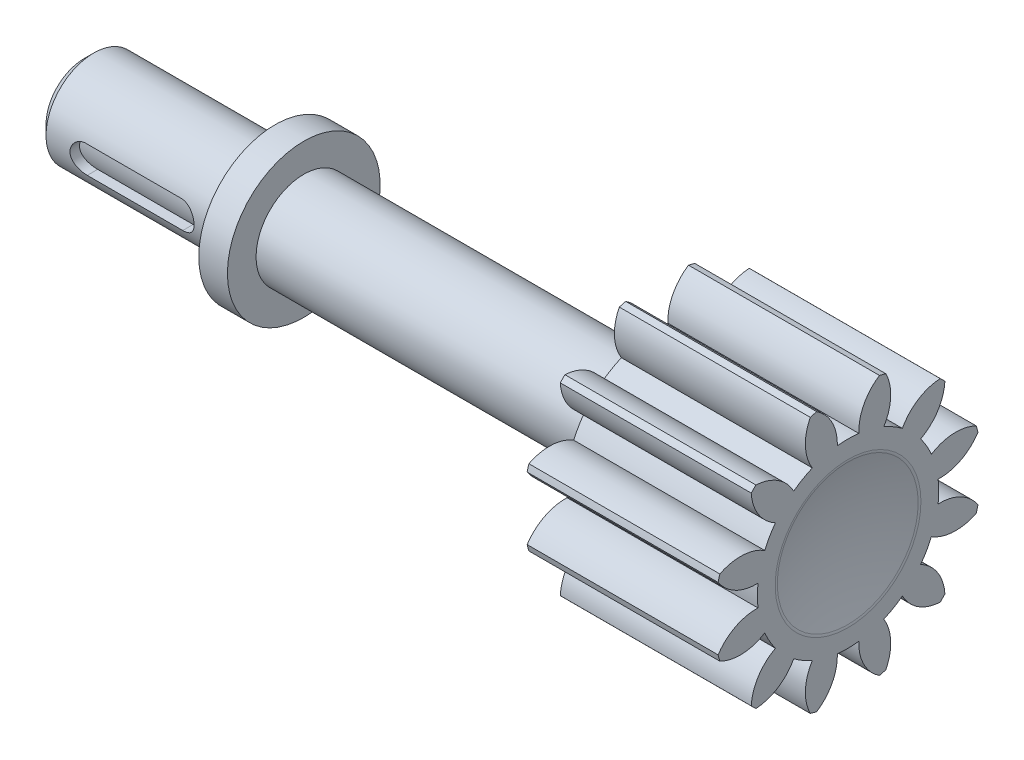
from build123d import *

# Parameters (mm, degrees)
SKETCH1_W                  = 10
SKETCH1_H                  = 7
CUT_EXTRUDE1_DEPTH         = 25.841675415
CUT_EXTRUDE2_DEPTH         = 25.841675415
CUT_EXTRUDE3_DEPTH         = 25.841675415
CUT_EXTRUDE4_DEPTH         = 25.841675415
CUT_EXTRUDE5_DEPTH         = 25.841675415
CUT_EXTRUDE6_DEPTH         = 25.841675415
CUT_EXTRUDE7_DEPTH         = 25.841675415
CUT_EXTRUDE8_DEPTH         = 25.841675415
CUT_EXTRUDE9_DEPTH         = 25.73038126
CUT_EXTRUDE10_DEPTH        = 25.73038126
CUT_EXTRUDE11_DEPTH        = 25.73038126
CUT_EXTRUDE12_DEPTH        = 25.590210189
SKETCH14_W                 = 30.0000508
SKETCH14_H                 = 2.5
F_0_8_0_8_DIAMETER_HOLE1_D = 0.8
BOSS_EXTRUDE1_START        = -40.0000508
SKETCH17_R                 = 0.4
BOSS_EXTRUDE1_DEPTH        = 40.0000508
SKETCH18_W                 = 1.5
SKETCH18_H                 = 1.5
CHAMFER1_SIZE              = 0.5
CUT_EXTRUDE13_REACH        = 34.638
CUT_EXTRUDE13_END_RADIUS   = 2
CUT_EXTRUDE13_START        = 5
FILLET1_R                  = 0.5


# Read off the part's stored shape, not the designer's step: Dome1
with BuildPart() as part:
    # Sketch1 → Revolve1 (revolve)
    with BuildSketch(Plane(origin=(0, 0, -7.196357143), x_dir=(-1, 0, 0), z_dir=(0, 0, -1)), mode=Mode.PRIVATE) as revolve1_sk:
        with Locations((-14.77870785, 14.264354232)):
            Rectangle(SKETCH1_W, SKETCH1_H)
    revolve(revolve1_sk.sketch.rotate(Axis((19.77870785, 10.764354232, -7.196357143), (-1, 0, 0)), 270), axis=Axis((19.77870785, 10.764354232, -7.196357143), (-1, 0, 0)))

    # Sketch2 → Cut-Extrude1 (cut, through all)
    with BuildSketch(Plane.ZY.offset(-9.77870785)):
        with BuildLine():
            ThreePointArc((-0.481894482, 12.743240579), (-1.134179317, 14.264354232), (-2.125359964, 15.589806295))
            ThreePointArc((-2.125359964, 15.589806295), (-2.500220073, 14.433413298), (-3.393627672, 13.609042188))
            ThreePointArc((-3.393627672, 13.609042188), (-3.083602501, 13.138854232), (-2.831420372, 12.635270579))
            ThreePointArc((-2.831420372, 12.635270579), (-1.670790249, 12.996798701), (-0.481894482, 12.743240579))
        make_face()
    extrude(amount=-CUT_EXTRUDE1_DEPTH, mode=Mode.SUBTRACT)

    # Sketch3 → Cut-Extrude2 (cut, through all)
    with BuildSketch(Plane.ZY.offset(-9.77870785)):
        with BuildLine():
            ThreePointArc((-0.392018732, 9.12088875), (-0.196357143, 10.764354232), (-0.392018732, 12.407819713))
            ThreePointArc((-0.392018732, 12.407819713), (-1.294853608, 11.593784056), (-2.480752839, 11.326561532))
            ThreePointArc((-2.480752839, 11.326561532), (-2.447357143, 10.764354232), (-2.480752839, 10.202146931))
            ThreePointArc((-2.480752839, 10.202146931), (-1.294853608, 9.934924408), (-0.392018732, 9.12088875))
        make_face()
    extrude(amount=-CUT_EXTRUDE2_DEPTH, mode=Mode.SUBTRACT)

    # Sketch4 → Cut-Extrude3 (cut, through all)
    with BuildSketch(Plane.ZY.offset(-9.77870785)):
        with BuildLine():
            ThreePointArc((-2.125359964, 5.938902169), (-1.134179317, 7.264354232), (-0.481894482, 8.785467884))
            ThreePointArc((-0.481894482, 8.785467884), (-1.670790249, 8.531909762), (-2.831420372, 8.893437884))
            ThreePointArc((-2.831420372, 8.893437884), (-3.083602501, 8.389854232), (-3.393627672, 7.919666275))
            ThreePointArc((-3.393627672, 7.919666275), (-2.500220073, 7.095295166), (-2.125359964, 5.938902169))
        make_face()
    extrude(amount=-CUT_EXTRUDE3_DEPTH, mode=Mode.SUBTRACT)

    # Sketch5 → Cut-Extrude4 (cut, through all)
    with BuildSketch(Plane.ZY.offset(-9.77870785)):
        with BuildLine():
            ThreePointArc((-5.217470795, 4.049891571), (-3.696357143, 4.702176405), (-2.37090508, 5.693357053))
            ThreePointArc((-2.37090508, 5.693357053), (-3.527298077, 6.068217161), (-4.351669187, 6.96162476))
            ThreePointArc((-4.351669187, 6.96162476), (-4.821857143, 6.651599589), (-5.325440796, 6.39941746))
            ThreePointArc((-5.325440796, 6.39941746), (-4.963912674, 5.238787337), (-5.217470795, 4.049891571))
        make_face()
    extrude(amount=-CUT_EXTRUDE4_DEPTH, mode=Mode.SUBTRACT)

    # Sketch6 → Cut-Extrude5 (cut, through all)
    with BuildSketch(Plane.ZY.offset(-9.77870785)):
        with BuildLine():
            ThreePointArc((-8.839822625, 3.960015821), (-7.196357143, 3.764354232), (-5.552891661, 3.960015821))
            ThreePointArc((-5.552891661, 3.960015821), (-6.366927319, 4.862850696), (-6.634149843, 6.048749928))
            ThreePointArc((-6.634149843, 6.048749928), (-7.196357143, 6.015354232), (-7.758564444, 6.048749928))
            ThreePointArc((-7.758564444, 6.048749928), (-8.025786967, 4.862850696), (-8.839822625, 3.960015821))
        make_face()
    extrude(amount=-CUT_EXTRUDE5_DEPTH, mode=Mode.SUBTRACT)

    # Sketch7 → Cut-Extrude6 (cut, through all)
    with BuildSketch(Plane.ZY.offset(-9.77870785)):
        with BuildLine():
            ThreePointArc((-12.021809206, 5.693357053), (-10.696357143, 4.702176405), (-9.175243491, 4.049891571))
            ThreePointArc((-9.175243491, 4.049891571), (-9.428801613, 5.238787337), (-9.067273491, 6.39941746))
            ThreePointArc((-9.067273491, 6.39941746), (-9.570857143, 6.651599589), (-10.0410451, 6.96162476))
            ThreePointArc((-10.0410451, 6.96162476), (-10.865416209, 6.068217161), (-12.021809206, 5.693357053))
        make_face()
    extrude(amount=-CUT_EXTRUDE6_DEPTH, mode=Mode.SUBTRACT)

    # Sketch8 → Cut-Extrude7 (cut, through all)
    with BuildSketch(Plane.ZY.offset(-9.77870785)):
        with BuildLine():
            ThreePointArc((-13.910819804, 8.785467884), (-13.25853497, 7.264354232), (-12.267354322, 5.938902169))
            ThreePointArc((-12.267354322, 5.938902169), (-11.892494213, 7.095295166), (-10.999086614, 7.919666275))
            ThreePointArc((-10.999086614, 7.919666275), (-11.309111786, 8.389854232), (-11.561293915, 8.893437884))
            ThreePointArc((-11.561293915, 8.893437884), (-12.721924037, 8.531909762), (-13.910819804, 8.785467884))
        make_face()
    extrude(amount=-CUT_EXTRUDE7_DEPTH, mode=Mode.SUBTRACT)

    # Sketch9 → Cut-Extrude8 (cut, through all)
    with BuildSketch(Plane.ZY.offset(-9.77870785)):
        with BuildLine():
            ThreePointArc((-14.000695554, 12.407819713), (-14.196357143, 10.764354232), (-14.000695554, 9.12088875))
            ThreePointArc((-14.000695554, 9.12088875), (-13.097860679, 9.934924408), (-11.911961447, 10.202146931))
            ThreePointArc((-11.911961447, 10.202146931), (-11.945357143, 10.764354232), (-11.911961447, 11.326561532))
            ThreePointArc((-11.911961447, 11.326561532), (-13.097860679, 11.593784056), (-14.000695554, 12.407819713))
        make_face()
    extrude(amount=-CUT_EXTRUDE8_DEPTH, mode=Mode.SUBTRACT)

    # Sketch10 → Cut-Extrude9 (cut, through all)
    with BuildSketch(Plane.ZY.offset(-9.77870785)):
        with BuildLine():
            ThreePointArc((-12.267354322, 15.589806295), (-13.25853497, 14.264354232), (-13.910819804, 12.743240579))
            ThreePointArc((-13.910819804, 12.743240579), (-12.721924037, 12.996798701), (-11.561293915, 12.635270579))
            ThreePointArc((-11.561293915, 12.635270579), (-11.309111786, 13.138854232), (-10.999086614, 13.609042188))
            ThreePointArc((-10.999086614, 13.609042188), (-11.892494213, 14.433413298), (-12.267354322, 15.589806295))
        make_face()
    extrude(amount=-CUT_EXTRUDE9_DEPTH, mode=Mode.SUBTRACT)

    # Sketch11 → Cut-Extrude10 (cut, through all)
    with BuildSketch(Plane.ZY.offset(-9.77870785)):
        with BuildLine():
            ThreePointArc((-9.175243491, 17.478816892), (-10.696357143, 16.826532058), (-12.021809206, 15.83535141))
            ThreePointArc((-12.021809206, 15.83535141), (-10.865416209, 15.460491302), (-10.0410451, 14.567083703))
            ThreePointArc((-10.0410451, 14.567083703), (-9.570857143, 14.877108874), (-9.067273491, 15.129291003))
            ThreePointArc((-9.067273491, 15.129291003), (-9.428801613, 16.289921126), (-9.175243491, 17.478816892))
        make_face()
    extrude(amount=-CUT_EXTRUDE10_DEPTH, mode=Mode.SUBTRACT)

    # Sketch12 → Cut-Extrude11 (cut, through all)
    with BuildSketch(Plane.ZY.offset(-9.77870785)):
        with BuildLine():
            ThreePointArc((-5.552891661, 17.568692642), (-7.196357143, 17.764354232), (-8.839822625, 17.568692642))
            ThreePointArc((-8.839822625, 17.568692642), (-8.025786967, 16.665857767), (-7.758564444, 15.479958536))
            ThreePointArc((-7.758564444, 15.479958536), (-7.196357143, 15.513354232), (-6.634149843, 15.479958536))
            ThreePointArc((-6.634149843, 15.479958536), (-6.366927319, 16.665857767), (-5.552891661, 17.568692642))
        make_face()
    extrude(amount=-CUT_EXTRUDE11_DEPTH, mode=Mode.SUBTRACT)

    # Sketch13 → Cut-Extrude12 (cut, through all)
    with BuildSketch(Plane.ZY.offset(-9.77870785)):
        with BuildLine():
            ThreePointArc((-2.37090508, 15.83535141), (-3.696357143, 16.826532058), (-5.217470795, 17.478816892))
            ThreePointArc((-5.217470795, 17.478816892), (-4.963912674, 16.289921126), (-5.325440796, 15.129291003))
            ThreePointArc((-5.325440796, 15.129291003), (-4.821857143, 14.877108874), (-4.351669187, 14.567083703))
            ThreePointArc((-4.351669187, 14.567083703), (-3.527298077, 15.460491302), (-2.37090508, 15.83535141))
        make_face()
    extrude(amount=-CUT_EXTRUDE12_DEPTH, mode=Mode.SUBTRACT)

    # Sketch14 → Revolve2 (revolve)
    with BuildSketch(Plane.XY.offset(-7.196357143), mode=Mode.PRIVATE) as revolve2_sk:
        with Locations((-5.22131755, 12.014354232)):
            Rectangle(SKETCH14_W, SKETCH14_H)
    revolve(revolve2_sk.sketch.rotate(Axis((-20.22134295, 10.764354232, -7.196357143), (1, 0, 0)), 270), axis=Axis((-20.22134295, 10.764354232, -7.196357143), (1, 0, 0)))

    # Ø0.8 (0.8) Diameter Hole1 (through all)
    with Locations(Plane(origin=(19.77870785, 0, 0), x_dir=(0, 0, -1), z_dir=(1, 0, 0))):
        with Locations((7.196357143, 10.764354232)):
            Hole(F_0_8_0_8_DIAMETER_HOLE1_D / 2)

    # Sketch17 → Boss-Extrude1 (add)
    with BuildSketch(Plane(origin=(19.77870785, 0, 0), x_dir=(0, 0, -1), z_dir=(1, 0, 0)).offset(BOSS_EXTRUDE1_START)):
        with Locations((7.196357143, 10.764354232)):
            Circle(SKETCH17_R)
    extrude(amount=BOSS_EXTRUDE1_DEPTH)

    # Sketch18 → Revolve3 (revolve)
    with BuildSketch(Plane.XY.offset(-7.196357143), mode=Mode.PRIVATE) as revolve3_sk:
        with Locations((-9.47134295, 14.014354232)):
            Rectangle(SKETCH18_W, SKETCH18_H)
    revolve(revolve3_sk.sketch.rotate(Axis((-20.22134295, 10.764354232, -7.196357143), (1, 0, 0)), 90), axis=Axis((-20.22134295, 10.764354232, -7.196357143), (1, 0, 0)))

    # Chamfer1
    chamfer1_edges = [part.edges().sort_by_distance(p)[0] for p in [
        (-20.22134295, 10.764354232, -4.696357143),
    ]]
    chamfer(chamfer1_edges, length=CHAMFER1_SIZE)

    # Cut-Extrude13: up to this cylinder (the profile starts outside it)
    cut_extrude13_end = Plane(origin=(-15.221343, 10.764354232, -7.196357143), z_dir=(1, 0, 0)) * Cylinder(CUT_EXTRUDE13_END_RADIUS, 74.276, mode=Mode.PRIVATE)
    # Sketch20 → Cut-Extrude13 (cut, up to the surface)
    with BuildSketch(Plane.XY.offset(-7.196357143).offset(CUT_EXTRUDE13_START), mode=Mode.PRIVATE) as cut_extrude13_sk1:
        with BuildLine():
            Line((-12.72134295, 9.882388481), (-17.72134295, 9.882388481))
            ThreePointArc((-17.72134295, 9.882388481), (-18.47134295, 10.632388481), (-17.72134295, 11.382388481))
            Line((-17.72134295, 11.382388481), (-12.72134295, 11.382388481))
            ThreePointArc((-12.72134295, 11.382388481), (-11.97134295, 10.632388481), (-12.72134295, 9.882388481))
        make_face()
    cut_extrude13_tool1 = extrude(cut_extrude13_sk1.sketch, amount=-CUT_EXTRUDE13_REACH, mode=Mode.PRIVATE) - cut_extrude13_end
    add(cut_extrude13_tool1.solids().sort_by_distance((-15.221343, 10.632388, -2.196357))[0], mode=Mode.SUBTRACT)

    # Dome1 outline → Dome1 (revolve, cut)
    with BuildSketch(Plane(origin=(0, 10.764354232, -7.196357143), x_dir=(0, 1, 0), z_dir=(0, 0, -1))):
        with BuildLine():
            Line((0, 19.778707854), (0, 19.27870785))
            ThreePointArc((0, 19.27870785), (1.891593251, 19.404258523), (3.750000014, 19.778707854))
            Line((3.750000014, 19.778707854), (0, 19.778707854))
        make_face()
    revolve(axis=Axis((0, 10.764354232, -7.196357143), (1, 0, 0)), mode=Mode.SUBTRACT)

    # Fillet1
    fillet1_edges = [part.edges().sort_by_distance(p)[0] for p in [
        (19.778707854, 7.014354218, -7.196357143),
    ]]
    fillet(fillet1_edges, radius=FILLET1_R)


solid = part.part
